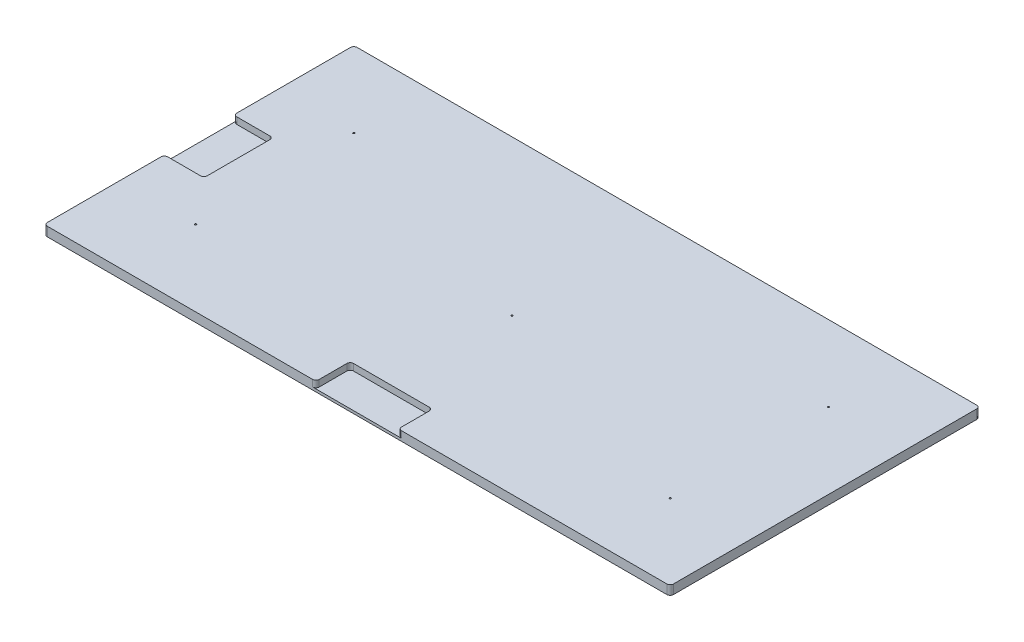
from build123d import *

# Parameters (mm, degrees)
SKETCH1_W                    = 1206.5
SKETCH1_H                    = 596.9
BOSS_EXTRUDE1_DEPTH          = 17.78
F_1_8_0_125_DIAMETER_HOLE1_D = 3.175
FILLET1_R                    = 6.35
SKETCH4_W                    = 158.75
SKETCH4_H                    = 66.04
SKETCH4_W_2                  = 76.2
SKETCH4_H_2                  = 133.35
CUT_EXTRUDE1_DEPTH           = 12.7
FILLET2_R                    = 6.35


with BuildPart() as part:
    # Sketch1 → Boss-Extrude1 (new body)
    with BuildSketch(Plane(origin=(0, 0, 0), x_dir=(1, 0, 0), z_dir=(0, 1, 0))):
        Rectangle(SKETCH1_W, SKETCH1_H)
    extrude(amount=BOSS_EXTRUDE1_DEPTH)

    # 1/8 (0.125) Diameter Hole1 (through all)
    with Locations(Plane(origin=(0, 17.78, 0), x_dir=(1, 0, 0), z_dir=(0, 1, 0))):
        with Locations((0, 0), (457.2, 152.4), (-457.2, -152.4), (-457.2, 152.4), (457.2, -152.4)):
            Hole(F_1_8_0_125_DIAMETER_HOLE1_D / 2)

    # Fillet1
    fillet1_edges = [part.edges().sort_by_distance(p)[0] for p in [
        (603.25, 8.89, -298.45),
        (603.25, 8.89, 298.45),
        (-603.25, 8.89, 298.45),
        (-603.25, 8.89, -298.45),
    ]]
    fillet(fillet1_edges, radius=FILLET1_R)

    # Sketch4 → Cut-Extrude1 (cut)
    with BuildSketch(Plane(origin=(0, 17.78, 0), x_dir=(1, 0, 0), z_dir=(0, 1, 0))):
        with Locations((0, -265.43)):
            Rectangle(SKETCH4_W, SKETCH4_H)
        with Locations((-565.15, 0)):
            Rectangle(SKETCH4_W_2, SKETCH4_H_2)
    extrude(amount=-CUT_EXTRUDE1_DEPTH, mode=Mode.SUBTRACT)

    # Fillet2
    fillet2_edges = [part.edges().sort_by_distance(p)[0] for p in [
        (79.375, 11.43, 298.45),
        (-79.375, 11.43, 298.45),
        (-79.375, 11.43, 232.41),
        (79.375, 11.43, 232.41),
        (-603.25, 11.43, 66.675),
        (-603.25, 11.43, -66.675),
        (-527.05, 11.43, 66.675),
        (-527.05, 11.43, -66.675),
    ]]
    fillet(fillet2_edges, radius=FILLET2_R)


solid = part.part
